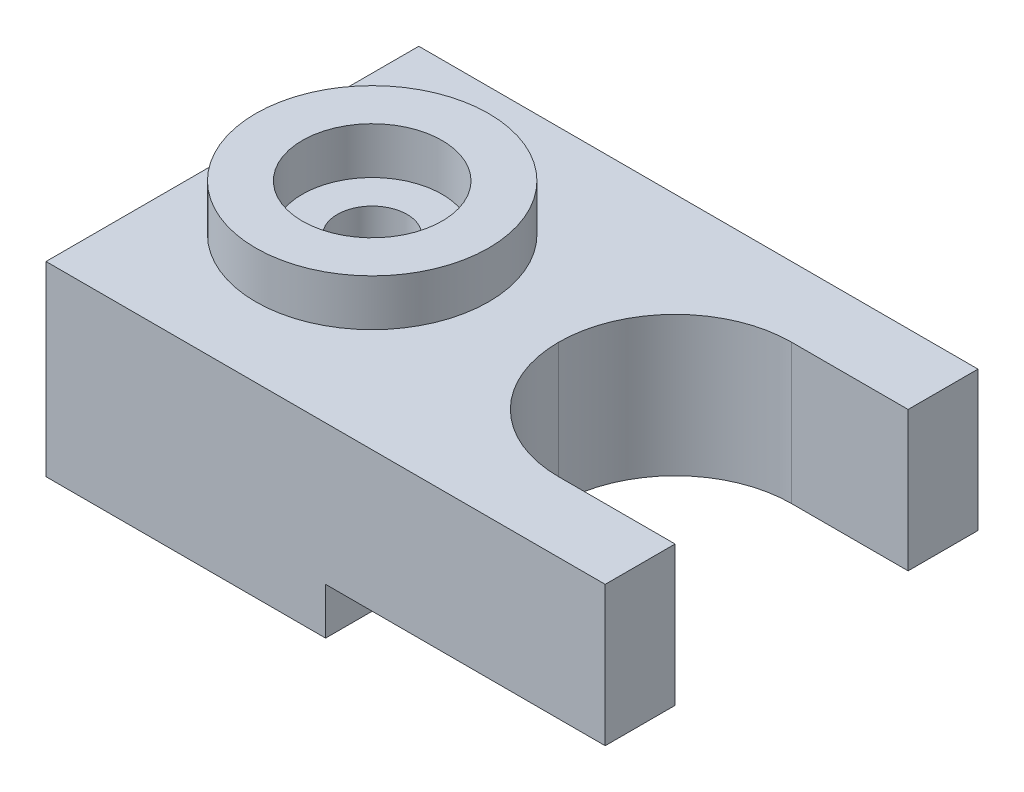
from build123d import *

# Parameters (mm, degrees)
SKETCH2_W               = 76.2
SKETCH2_H               = 25.4
BOSS_EXTRUDE1_DEPTH     = 25.4
SKETCH3_W               = 38.1
SKETCH3_H               = 6.35
CUT_EXTRUDE1_DEPTH      = 65.757547823
CUT_EXTRUDE2_DEPTH      = 48.519048812
CUT_EXTRUDE2_DEPTH_BACK = 48.519048812
SKETCH4_W               = 31.75
SKETCH4_H               = 31.75
FILLET2_R               = 15.875
SKETCH5_R               = 15.875
BOSS_EXTRUDE2_DEPTH     = 6.35
HOLE1_D                 = 9.525
HOLE1_DEPTH             = 31.75
HOLE1_CBORE_D           = 19.05
HOLE1_CBORE_DEPTH       = 6.35
HOLE1_TIP               = 2.861598698


with BuildPart() as part:
    # Sketch2 → Boss-Extrude1 (new, symmetric)
    with BuildSketch(Plane.XY):
        Rectangle(SKETCH2_W, SKETCH2_H)
    extrude(amount=BOSS_EXTRUDE1_DEPTH, both=True)

    # Sketch3 → Cut-Extrude1 (cut, through all)
    with BuildSketch(Plane.XY.offset(25.4)):
        with Locations((19.05, -9.525)):
            Rectangle(SKETCH3_W, SKETCH3_H)
    extrude(amount=-CUT_EXTRUDE1_DEPTH, mode=Mode.SUBTRACT)

    # Sketch4 → Cut-Extrude2 (cut, two sides: drawn at the far end of the back side and taken through both)
    with BuildSketch(Plane(origin=(0, 0, 0), x_dir=(1, 0, 0), z_dir=(0, 1, 0)).offset(-CUT_EXTRUDE2_DEPTH_BACK)):
        with Locations((22.225, 0)):
            Rectangle(SKETCH4_W, SKETCH4_H)
    extrude(amount=CUT_EXTRUDE2_DEPTH + CUT_EXTRUDE2_DEPTH_BACK, mode=Mode.SUBTRACT)

    # Fillet2
    fillet2_edges = [part.edges().sort_by_distance(p)[0] for p in [
        (6.35, 3.175, 15.875),
        (6.35, 3.175, -15.875),
    ]]
    fillet(fillet2_edges, radius=FILLET2_R - 0.0001)  # a hair under: the kernel refuses the full size

    # Sketch5 → Boss-Extrude2 (add)
    with BuildSketch(Plane(origin=(0, 12.7, 0), x_dir=(1, 0, 0), z_dir=(0, 1, 0))):
        with Locations(Location((-19.05, 0, 0), (0, 0, 90))):
            Circle(SKETCH5_R)
    extrude(amount=BOSS_EXTRUDE2_DEPTH)

    # Hole1
    with Locations(Plane(origin=(-19.05, 19.05, 0), x_dir=(0, 0, 1), z_dir=(0, 1, 0))):
        with Locations((0, 0)):
            CounterBoreHole(HOLE1_D / 2, HOLE1_CBORE_D / 2, HOLE1_CBORE_DEPTH, depth=HOLE1_DEPTH)
            with Locations((0, 0, -(HOLE1_DEPTH + HOLE1_TIP / 2))):  # 118° drill point
                Cone(0, HOLE1_D / 2, HOLE1_TIP, mode=Mode.SUBTRACT)


solid = part.part
